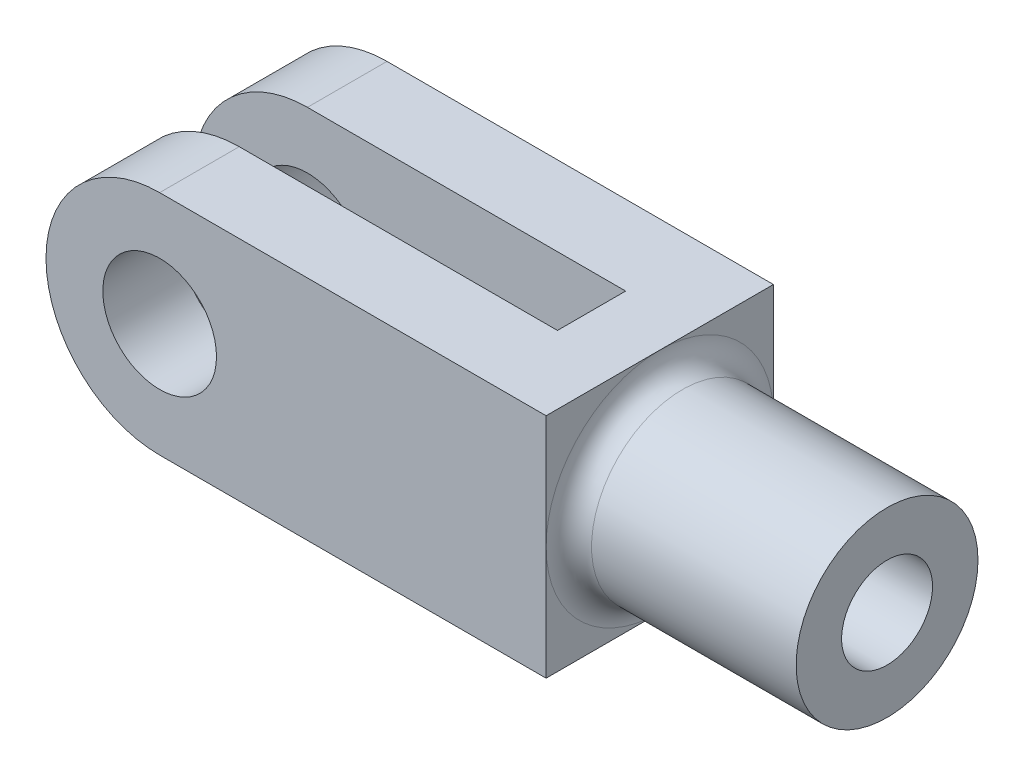
from build123d import *

# Parameters (mm, degrees)
SKETCH1_R               = 2.5
BOSS_EXTRUDE1_DEPTH     = 5
CUT_EXTRUDE1_DEPTH      = 19.41195264
CUT_EXTRUDE1_DEPTH_BACK = 19.41195264
SKETCH2_W               = 19
SKETCH2_H               = 3
SKETCH3_R               = 4
SKETCH3_R_2             = 2
BOSS_EXTRUDE2_DEPTH     = 10
FILLET1_R               = 1


with BuildPart() as part:
    # Sketch1 → Boss-Extrude1 (new, symmetric)
    with BuildSketch(Plane.XY):
        with BuildLine():
            ThreePointArc((0, -5), (-5, 0), (0, 5))
            Line((0, 5), (17, 5))
            Line((17, 5), (17, -5))
            Line((17, -5), (0, -5))
        make_face()
        Circle(SKETCH1_R, mode=Mode.SUBTRACT)
    extrude(amount=BOSS_EXTRUDE1_DEPTH, both=True)

    # Sketch2 → Cut-Extrude1 (cut, two sides: drawn at the far end of the back side and taken through both)
    with BuildSketch(Plane(origin=(0, 0, 0), x_dir=(1, 0, 0), z_dir=(0, 1, 0)).offset(-CUT_EXTRUDE1_DEPTH_BACK)):
        with Locations((4.5, 0)):
            Rectangle(SKETCH2_W, SKETCH2_H)
    extrude(amount=CUT_EXTRUDE1_DEPTH + CUT_EXTRUDE1_DEPTH_BACK, mode=Mode.SUBTRACT)

    # Sketch3 → Boss-Extrude2 (add)
    with BuildSketch(Plane(origin=(17, 0, 0), x_dir=(0, 0, -1), z_dir=(1, 0, 0))):
        Circle(SKETCH3_R)
        Circle(SKETCH3_R_2, mode=Mode.SUBTRACT)
    extrude(amount=BOSS_EXTRUDE2_DEPTH)

    # Fillet1
    fillet1_edges = [part.edges().sort_by_distance(p)[0] for p in [
        (17, 0, 4),
    ]]
    fillet(fillet1_edges, radius=FILLET1_R - 0.0001)  # a hair under: the kernel refuses the full size


solid = part.part
